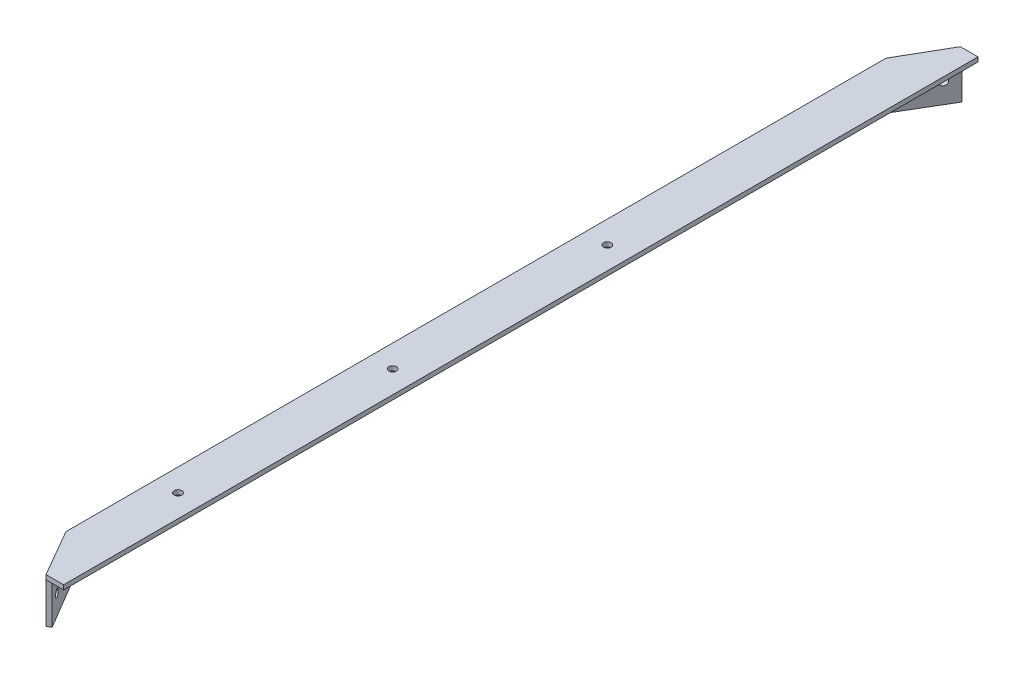
from build123d import *

# Parameters (mm, degrees)
BOSS_EXTRUDE1_DEPTH     = 640
BOSS_EXTRUDE2_DEPTH     = 63
BOSS_EXTRUDE3_DEPTH     = 7
SKETCH26_R              = 6
CUT_EXTRUDE2_DEPTH      = 10
CUT_EXTRUDE1_DEPTH      = 10
CUT_EXTRUDE1_DEPTH_BACK = 10
SKETCH28_R              = 6


with BuildPart() as part:
    # Sketch1 → Boss-Extrude1 (new body)
    with BuildSketch(Plane.XY):
        Polygon((0, 0), (0, 70), (70, 70), (70, 63), (7, 63), (7, 0), align=None)
    extrude(amount=BOSS_EXTRUDE1_DEPTH)

    # Sketch23 → Boss-Extrude2 (add)
    with BuildSketch(Plane(origin=(0, 0, 0), x_dir=(1, 0, 0), z_dir=(0, 1, 0))):
        Polygon((0, -640), (42.5, -713.612159322), (48.562177826, -710.112159322), (7, -640), align=None)
    extrude(amount=BOSS_EXTRUDE2_DEPTH)

    # Sketch25 → Boss-Extrude3 (add)
    with BuildSketch(Plane(origin=(0, 63, 0), x_dir=(1, 0, 0), z_dir=(0, 1, 0))):
        Polygon((70, -640), (0, -640), (42.5, -713.612159322), (70, -713.612159322), align=None)
    extrude(amount=BOSS_EXTRUDE3_DEPTH)

    # Sketch26 → Cut-Extrude2 (cut)
    with BuildSketch(Plane(origin=(-275.556719825, 0, 163.348804279), x_dir=(-0.5099316128113042, 0, -0.8602149442178172), z_dir=(0.8602149442178172, 0, -0.5099316128113042))):
        with Locations((-614.36248118, 31.5)):
            Circle(SKETCH26_R)
        with Locations((-575.357085589, 31.5)):
            Circle(SKETCH26_R)
    extrude(amount=-CUT_EXTRUDE2_DEPTH, mode=Mode.SUBTRACT)

    # Mirror1: part across plane


with BuildPart() as part_1:
    add(part.part)
    add(part.part.mirror(Plane.XY))

    # Sketch28 → Cut-Extrude1 (cut, two sides: drawn at the far end of the back side and taken through both)
    with BuildSketch(Plane(origin=(0, 70, 0), x_dir=(1, 0, 0), z_dir=(0, 1, 0)).offset(-CUT_EXTRUDE1_DEPTH_BACK)):
        with Locations((35, -500)):
            Circle(SKETCH28_R)
        with Locations((35, -165)):
            Circle(SKETCH28_R)
        with Locations((35, 170)):
            Circle(SKETCH28_R)
    extrude(amount=CUT_EXTRUDE1_DEPTH + CUT_EXTRUDE1_DEPTH_BACK, mode=Mode.SUBTRACT)


solid = part_1.part
